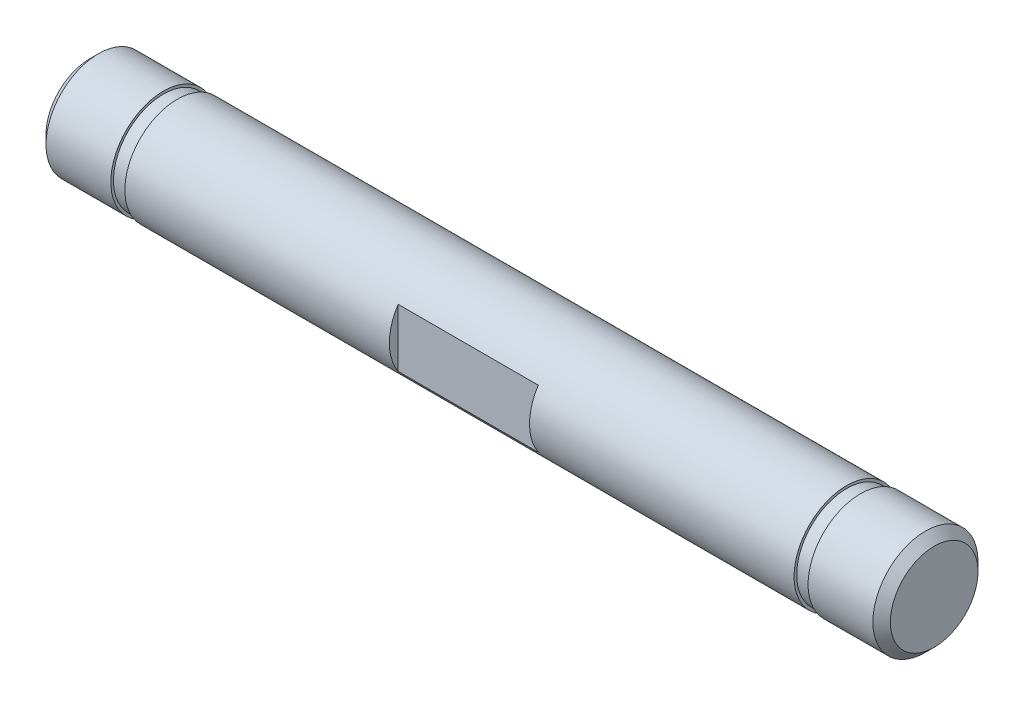
from build123d import *

# Parameters (mm, degrees)
CORTAR_EXTRUIR1_DEPTH = 4
CHAFL_N1_SIZE         = 0.5


with BuildPart() as part:
    # Croquis1 → Revolución1 (revolve)
    with BuildSketch(Plane(origin=(0, 0, 0), x_dir=(-1, 0, 0), z_dir=(0, 1, 0))):
        Polygon((-19.1, 3), (19.1, 3), (19.1, 2.85), (19.9, 2.85), (19.9, 3), (24.1, 3), (24.1, 0), (-24.1, 0), (-24.1, 3), (-19.9, 3), (-19.9, 2.85), (-19.1, 2.85), align=None)
    revolve(axis=Axis((24.1, 0, 0), (-1, 0, 0)))

    # Croquis2 → Cortar-Extruir1 (cut, symmetric)
    with BuildSketch(Plane.YZ):
        with BuildLine():
            Line((1.658312395, 2.5), (-1.658312395, 2.5))
            ThreePointArc((-1.658312395, 2.5), (0, 3), (1.658312395, 2.5))
        make_face()
    extrude(amount=CORTAR_EXTRUIR1_DEPTH, both=True, mode=Mode.SUBTRACT)

    # Chaflán1
    chafl_n1_edges = [part.edges().sort_by_distance(p)[0] for p in [
        (-24.1, 0, -3),
        (24.1, 0, -3),
    ]]
    chamfer(chafl_n1_edges, length=CHAFL_N1_SIZE)


solid = part.part
